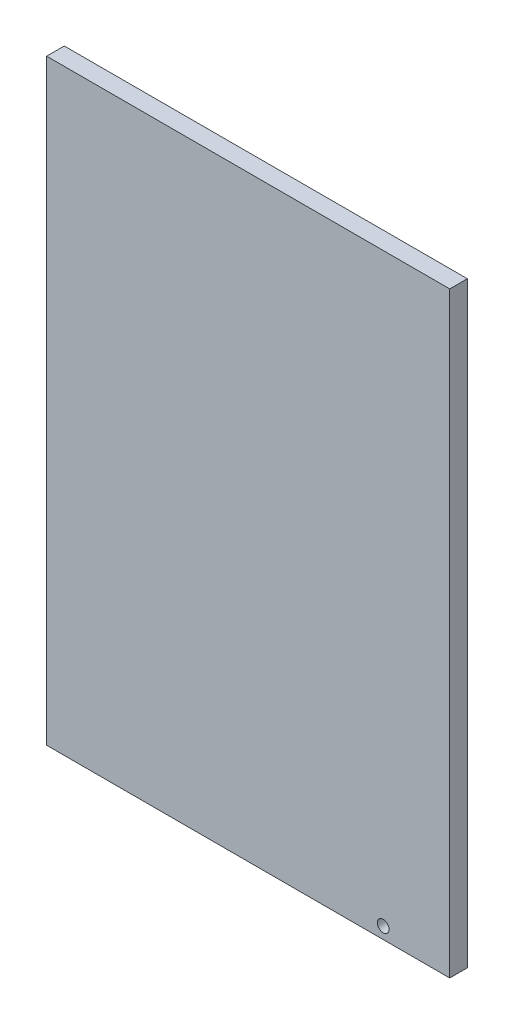
from build123d import *

# Parameters (mm, degrees)
SKETCH1_W           = 206
SKETCH1_H           = 305
BOSS_EXTRUDE1_DEPTH = 9
SKETCH2_R           = 3
CUT_EXTRUDE1_DEPTH  = 185.245081345


with BuildPart() as part:
    # Sketch1 → Boss-Extrude1 (new body)
    with BuildSketch(Plane.XY):
        Rectangle(SKETCH1_W, SKETCH1_H)
    extrude(amount=BOSS_EXTRUDE1_DEPTH)

    # Sketch2 → Cut-Extrude1 (cut, through all)
    with BuildSketch(Plane.XY.offset(9)):
        with Locations((69, -146.5)):
            Circle(SKETCH2_R)
    extrude(amount=-CUT_EXTRUDE1_DEPTH, mode=Mode.SUBTRACT)


solid = part.part
